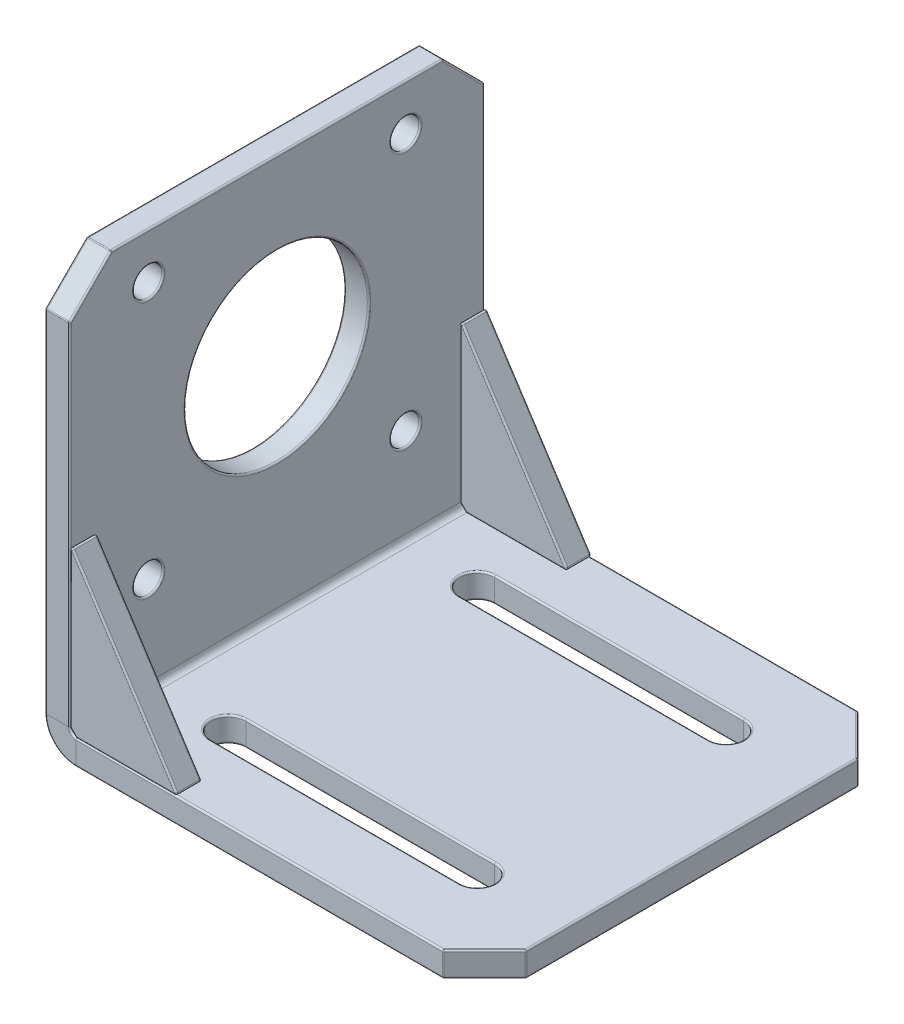
from build123d import *

# Parameters (mm, degrees)
SCHIZZO1_W                     = 53
SCHIZZO1_H                     = 3
BASE_FLANGIA1_DEPTH            = 25
BORDO_FLANGIA1_STRIP_W         = 13.4732
BORDO_FLANGIA1_STRIP_H         = 3
BORDO_FLANGIA1_STRIP_CUT_DEPTH = 50
BORDO_FLANGIA1_DEPTH           = 50
SCHIZZO10_R                    = 11.05
SCHIZZO10_R_2                  = 1.75
TAGLIO_ESTRUSIONE1_DEPTH       = 74.681748079
TAGLIO_ESTRUSIONE3_DEPTH       = 76.749587458
ESTRUSIONE_ESTRUSIONE3_START   = 25
ESTRUSIONE_ESTRUSIONE3_DEPTH   = 3
SMUSSO1_SIZE                   = 5
RACCORDO1_R                    = 0.2
RACCORDO2_R                    = 0.2
RACCORDO3_R                    = 0.2


# Sheet-metal steps are written as plain solids
with BuildPart() as part:
    # Schizzo1 → Base-Flangia1 (new, symmetric)
    with BuildSketch(Plane.XY):
        with Locations((26.5, -1.5)):
            Rectangle(SCHIZZO1_W, SCHIZZO1_H)
    extrude(amount=BASE_FLANGIA1_DEPTH, both=True)

    # Bordo-Flangia1 strip (across the edge) → Bordo-Flangia1 strip cut (cut)
    with BuildSketch(Plane.XY.offset(-25)):
        with Locations((-3, -1.5)):
            Rectangle(BORDO_FLANGIA1_STRIP_W, BORDO_FLANGIA1_STRIP_H)
    extrude(amount=BORDO_FLANGIA1_STRIP_CUT_DEPTH, mode=Mode.SUBTRACT)

    # Bordo-Flangia1 section (across the edge) → Bordo-Flangia1 (add)
    with BuildSketch(Plane.XY.offset(-25)):
        with BuildLine():
            Line((0, 0.7366), (0, 48))
            Line((0, 48), (3, 48))
            Line((3, 48), (3, 0.7366))
            ThreePointArc((3, 0.7366), (3.215745145, 0.215745145), (3.7366, 0))
            Line((3.7366, 0), (3.7366, -3))
            ThreePointArc((3.7366, -3), (1.094424801, -1.905575199), (0, 0.7366))
        make_face()
    extrude(amount=BORDO_FLANGIA1_DEPTH)

    # Schizzo10 → Taglio-Estrusione1 (cut, through all)
    with BuildSketch(Plane(origin=(3, 0, 0), x_dir=(0, 0, -1), z_dir=(1, 0, 0))):
        with Locations(Location((0, 27, 0), (0, 0, 90))):
            Circle(SCHIZZO10_R)
        with Locations(Location((-15.5, 42.5, 0), (0, 0, 90))):
            Circle(SCHIZZO10_R_2)
        with Locations(Location((15.5, 42.5, 0), (0, 0, 270))):
            Circle(SCHIZZO10_R_2)
        with Locations(Location((-15.5, 11.5, 0), (0, 0, 270))):
            Circle(SCHIZZO10_R_2)
        with Locations(Location((15.5, 11.5, 0), (0, 0, 90))):
            Circle(SCHIZZO10_R_2)
    extrude(amount=-TAGLIO_ESTRUSIONE1_DEPTH, mode=Mode.SUBTRACT)

    # Schizzo12 → Taglio-Estrusione3 (cut, through all)
    with BuildSketch(Plane(origin=(0, 0, 0), x_dir=(1, 0, 0), z_dir=(0, 1, 0))):
        with BuildLine():
            Line((42, 13), (12, 13))
            ThreePointArc((12, 13), (9.9, 15.1), (12, 17.2))
            Line((12, 17.2), (42, 17.2))
            ThreePointArc((42, 17.2), (44.1, 15.1), (42, 13))
        make_face()
        with BuildLine():
            Line((42, -17), (12, -17))
            ThreePointArc((12, -17), (9.9, -14.9), (12, -12.8))
            Line((12, -12.8), (42, -12.8))
            ThreePointArc((42, -12.8), (44.1, -14.9), (42, -17))
        make_face()
    extrude(amount=-TAGLIO_ESTRUSIONE3_DEPTH, mode=Mode.SUBTRACT)

    # Smusso1
    smusso1_edges = [part.edges().sort_by_distance(p)[0] for p in [
        (1.5, 48, -25),
        (1.5, 48, 25),
        (53, -1.5, -25),
        (53, -1.5, 25),
    ]]
    chamfer(smusso1_edges, length=SMUSSO1_SIZE)

    # Raccordo1
    raccordo1_edges = [part.edges().sort_by_distance(p)[0] for p in [
        (53, 0, 0),
        (53, -3, 0),
        (53, -1.5, -20),
        (53, -1.5, 20),
        (50.5, -3, -22.5),
        (50.5, -3, 22.5),
        (48, -1.5, 25),
        (50.5, 0, -22.5),
        (50.5, 0, 22.5),
        (48, -1.5, -25),
        (0, 21.8683, -25),
        (3, 21.8683, -25),
        (1.5, 43, -25),
        (3, 48, 0),
        (25.8683, -3, -25),
        (3, 45.5, 22.5),
        (3, 45.5, -22.5),
        (0, 48, 0),
        (1.5, 48, 20),
        (1.5, 48, -20),
        (25.8683, 0, -25),
        (0, 45.5, 22.5),
        (0, 45.5, -22.5),
        (1.5, 43, 25),
        (25.8683, -3, 25),
        (25.8683, 0, 25),
        (1.094424801, -1.905575199, -25),
        (1.094424801, -1.905575199, 25),
        (3.215745145, 0.215745145, -25),
        (3.215745145, 0.215745145, 25),
        (3, 21.8683, 25),
        (0, 21.8683, 25),
        (0, 9.75, -15.5),
        (3, 9.75, -15.5),
        (0, 13.25, 15.5),
        (3, 13.25, 15.5),
        (0, 44.25, -15.5),
        (3, 44.25, -15.5),
        (0, 40.75, 15.5),
        (3, 40.75, 15.5),
        (0, 15.95, 0),
        (3, 15.95, 0),
        (44.1, -3, -15.1),
        (27, -3, -13),
        (9.9, -3, -15.1),
        (27, -3, -17.2),
        (44.1, 0, -15.1),
        (27, 0, -17.2),
        (9.9, 0, -15.1),
        (27, 0, -13),
        (44.1, -3, 14.9),
        (27, -3, 17),
        (9.9, -3, 14.9),
        (27, -3, 12.8),
        (44.1, 0, 14.9),
        (27, 0, 12.8),
        (9.9, 0, 14.9),
        (27, 0, 17),
    ]]
    fillet(raccordo1_edges, radius=RACCORDO1_R)


with BuildPart() as body_2:
    # Schizzo15 → Estrusione-Estrusione3 (new body)
    with BuildSketch(Plane.XY.offset(ESTRUSIONE_ESTRUSIONE3_START)):
        Polygon((3, 20), (16, 0), (3.7366, 0), (3, 0.7366), align=None)
    extrude(amount=-ESTRUSIONE_ESTRUSIONE3_DEPTH)


with BuildPart() as body_3:
    # Specchia5: mirrored copy
    add(body_2.part.mirror(Plane.XY))

    # Raccordo2
    raccordo2_edges = [body_3.edges().sort_by_distance(p)[0] for p in [
        (3, 10.3683, -22),
        (3.3683, 0.3683, -22),
        (9.8683, 0, -22),
        (3.3683, 0.3683, -25),
        (3, 10.3683, -25),
        (9.5, 10, -25),
        (9.8683, 0, -25),
        (9.5, 10, -22),
        (3, 20, -23.5),
        (16, 0, -23.5),
    ]]
    fillet(raccordo2_edges, radius=RACCORDO2_R)


with BuildPart() as body_2_1:
    add(body_2.part)

    # Raccordo3
    raccordo3_edges = [body_2_1.edges().sort_by_distance(p)[0] for p in [
        (3, 10.3683, 22),
        (3.3683, 0.3683, 22),
        (9.8683, 0, 22),
        (3.3683, 0.3683, 25),
        (3, 10.3683, 25),
        (9.5, 10, 25),
        (9.8683, 0, 25),
        (9.5, 10, 22),
        (3, 20, 23.5),
        (16, 0, 23.5),
    ]]
    fillet(raccordo3_edges, radius=RACCORDO3_R)


solid = Compound([part.part, body_3.part, body_2_1.part])
